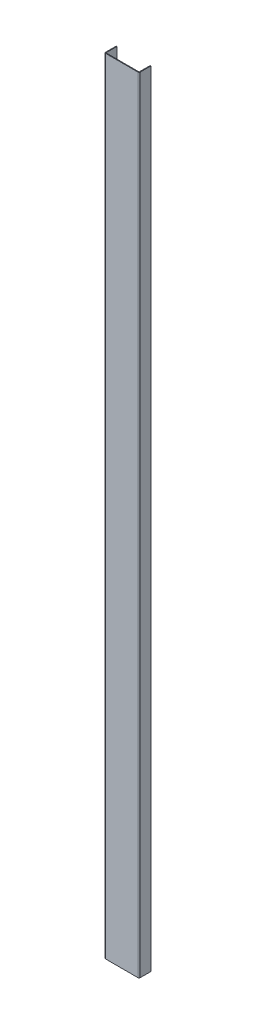
from build123d import *

# Parameters (mm, degrees)
BASE_FLANGE1_DEPTH = 1803.4


# Sheet-metal steps are written as plain solids
with BuildPart() as part:
    # Sketch1 → Base-Flange1 (new body)
    with BuildSketch(Plane(origin=(0, 0, 0), x_dir=(1, 0, 0), z_dir=(0, 1, 0))):
        with BuildLine():
            Line((38.1, 12.7), (38.1, -11.9634))
            ThreePointArc((38.1, -11.9634), (37.884254855, -12.484254855), (37.3634, -12.7))
            Line((37.3634, -12.7), (-37.3634, -12.7))
            ThreePointArc((-37.3634, -12.7), (-37.884254855, -12.484254855), (-38.1, -11.9634))
            Line((-38.1, -11.9634), (-38.1, 12.7))
            Line((-38.1, 12.7), (-39.6875, 12.7))
            Line((-39.6875, 12.7), (-39.6875, -11.9634))
            ThreePointArc((-39.6875, -11.9634), (-39.00678687, -13.60678687), (-37.3634, -14.2875))
            Line((-37.3634, -14.2875), (37.3634, -14.2875))
            ThreePointArc((37.3634, -14.2875), (39.00678687, -13.60678687), (39.6875, -11.9634))
            Line((39.6875, -11.9634), (39.6875, 12.7))
            Line((39.6875, 12.7), (38.1, 12.7))
        make_face()
    extrude(amount=BASE_FLANGE1_DEPTH)


solid = part.part
